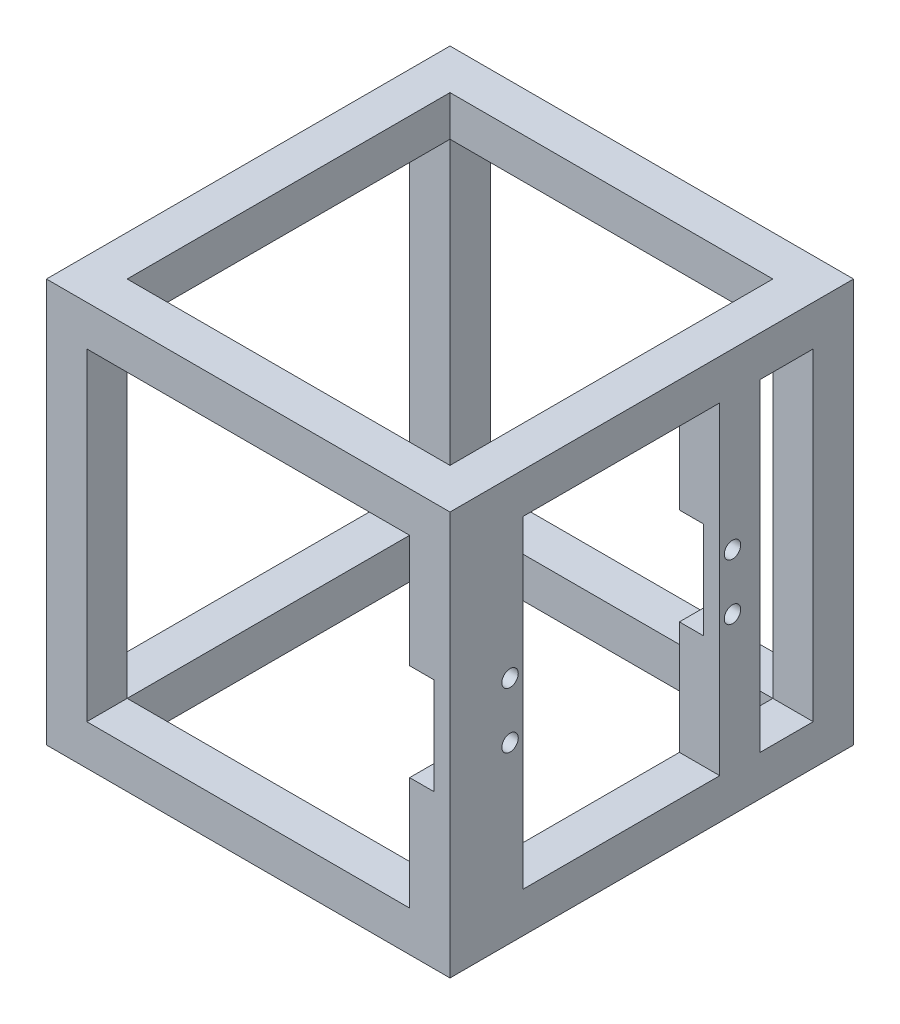
from build123d import *

# Parameters (mm, degrees)
SKETCH1_W          = 50
SKETCH1_H          = 50
SKETCH1_W_2        = 40
SKETCH1_H_2        = 40
EXTRUDE1_DEPTH     = 50
SKETCH2_W          = 40
SKETCH2_H          = 40
CUT_EXTRUDE1_DEPTH = 50
SKETCH3_W          = 40
SKETCH3_H          = 40
CUT_EXTRUDE2_DEPTH = 10
SKETCH4_W          = 24.4
SKETCH4_H          = 40
SKETCH4_W_2        = 6.57952911
CUT_EXTRUDE3_DEPTH = 10
SKETCH5_R          = 1.016
CUT_EXTRUDE4_DEPTH = 10
SKETCH6_W          = 3
SKETCH6_H          = 12
CUT_EXTRUDE5_DEPTH = 40


with BuildPart() as part:
    # Sketch1 → Extrude1 (new body)
    with BuildSketch(Plane.XY):
        with Locations((-25, 25)):
            Rectangle(SKETCH1_W, SKETCH1_H)
        with Locations((-25, 25)):
            Rectangle(SKETCH1_W_2, SKETCH1_H_2, mode=Mode.SUBTRACT)
    extrude(amount=EXTRUDE1_DEPTH)

    # Sketch2 → Cut-Extrude1 (cut)
    with BuildSketch(Plane.XZ):
        with Locations((-25, 25)):
            Rectangle(SKETCH2_W, SKETCH2_H)
    extrude(amount=-CUT_EXTRUDE1_DEPTH, mode=Mode.SUBTRACT)

    # Sketch3 → Cut-Extrude2 (cut)
    with BuildSketch(Plane.ZY.offset(50)):
        with Locations((25, 25)):
            Rectangle(SKETCH3_W, SKETCH3_H)
    extrude(amount=-CUT_EXTRUDE2_DEPTH, mode=Mode.SUBTRACT)

    # Sketch4 → Cut-Extrude3 (cut)
    with BuildSketch(Plane(origin=(0, 0, 0), x_dir=(0, 0, -1), z_dir=(1, 0, 0))):
        with Locations((-28.77952911, 25)):
            Rectangle(SKETCH4_W, SKETCH4_H)
        with Locations((-8.289764555, 25)):
            Rectangle(SKETCH4_W_2, SKETCH4_H)
    extrude(amount=-CUT_EXTRUDE3_DEPTH, mode=Mode.SUBTRACT)

    # Sketch5 → Cut-Extrude4 (cut)
    with BuildSketch(Plane(origin=(0, 0, 0), x_dir=(0, 0, -1), z_dir=(1, 0, 0))):
        with Locations((-42.55752911, 28.46)):
            Circle(SKETCH5_R)
        with Locations((-42.55752911, 21.53620247)):
            Circle(SKETCH5_R)
        with Locations((-15.00152911, 21.53620247)):
            Circle(SKETCH5_R)
        with Locations((-15.00152911, 28.46)):
            Circle(SKETCH5_R)
    extrude(amount=-CUT_EXTRUDE4_DEPTH, mode=Mode.SUBTRACT)

    # Sketch6 → Cut-Extrude5 (cut)
    with BuildSketch(Plane.XY.offset(50)):
        with Locations((-3.5, 25)):
            Rectangle(SKETCH6_W, SKETCH6_H)
    extrude(amount=-CUT_EXTRUDE5_DEPTH, mode=Mode.SUBTRACT)


solid = part.part
